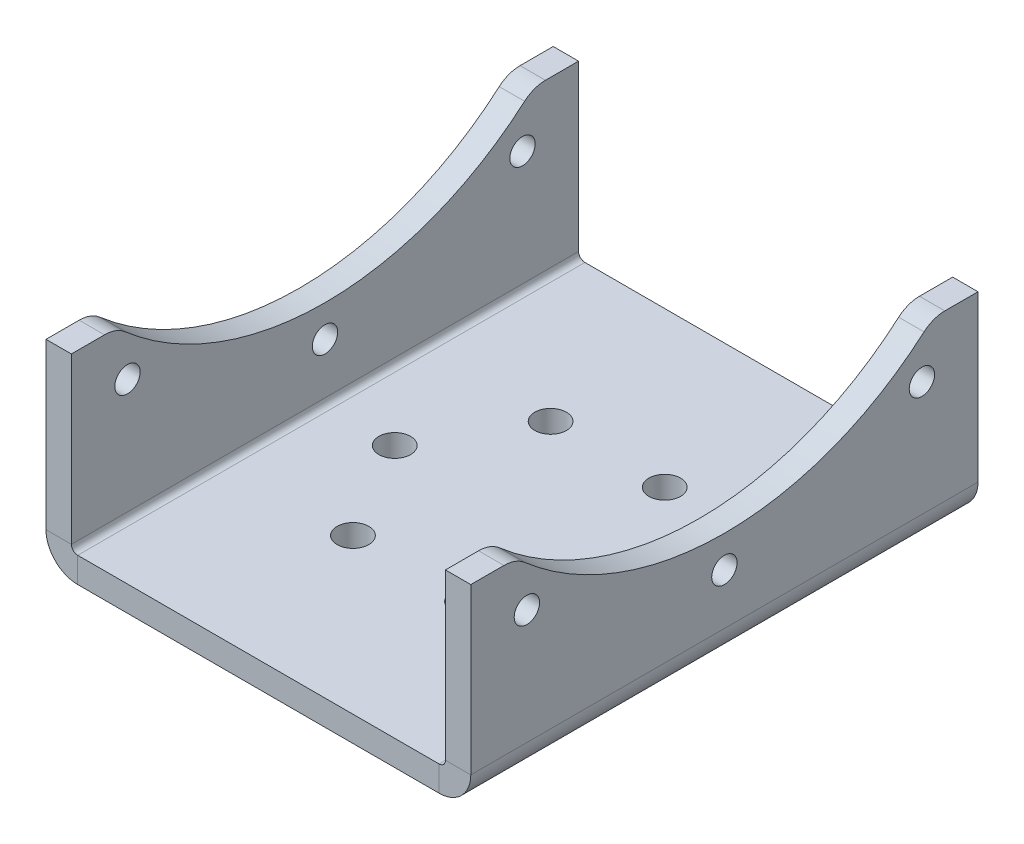
from build123d import *

# Parameters (mm, degrees)
SM_BASE_FLANGE_1_DEPTH   = 80
CUT_EXTRUDE_3_DEPTH      = 108.786826653
CUT_EXTRUDE_3_DEPTH_BACK = 108.786826653
SKETCH_6_R               = 48
SKETCH_6_R_2             = 2
FILLET_1_R               = 5
SKETCH_9_R               = 2.5
CUT_EXTRUDE_4_DEPTH      = 93.104560148


# Sheet-metal steps are written as plain solids
with BuildPart() as part:
    # Sketch 1 → Базовая кромка1 (new body)
    with BuildSketch(Plane.XY):
        with BuildLine():
            Line((-29.5, 27), (-29.5, 1))
            ThreePointArc((-29.5, 1), (-29.207106781, 0.292893219), (-28.5, 0))
            Line((-28.5, 0), (28.5, 0))
            ThreePointArc((28.5, 0), (29.207106781, 0.292893219), (29.5, 1))
            Line((29.5, 1), (29.5, 27))
            Line((29.5, 27), (33.5, 27))
            Line((33.5, 27), (33.5, 1))
            ThreePointArc((33.5, 1), (32.035533906, -2.535533906), (28.5, -4))
            Line((28.5, -4), (-28.5, -4))
            ThreePointArc((-28.5, -4), (-32.035533906, -2.535533906), (-33.5, 1))
            Line((-33.5, 1), (-33.5, 27))
            Line((-33.5, 27), (-29.5, 27))
        make_face()
    extrude(amount=SM_BASE_FLANGE_1_DEPTH)

    # Эскиз6 → Вырез-Вытянуть3 (cut, two sides: drawn at the far end of the back side and taken through both)
    with BuildSketch(Plane.ZY.offset(33.5).offset(-CUT_EXTRUDE_3_DEPTH_BACK)):
        with Locations((40, 62)):
            Circle(SKETCH_6_R)
        with Locations((40, 9)):
            Circle(SKETCH_6_R_2)
        with Locations((8.847381628, 19.122099298)):
            Circle(SKETCH_6_R_2)
        with Locations((71.152618372, 19.122099298)):
            Circle(SKETCH_6_R_2)
    extrude(amount=CUT_EXTRUDE_3_DEPTH + CUT_EXTRUDE_3_DEPTH_BACK, mode=Mode.SUBTRACT)

    # Скругление1
    fillet_1_edges = [part.edges().sort_by_distance(p)[0] for p in [
        (31.5, 27, 7.151864589),
        (31.5, 27, 72.848135411),
        (-31.5, 27, 7.151864589),
        (-31.5, 27, 72.848135411),
    ]]
    fillet(fillet_1_edges, radius=FILLET_1_R)

    # Эскиз9 → Вырез-Вытянуть4 (cut, through all)
    with BuildSketch(Plane.XZ.offset(4)):
        with Locations((17.5, 40)):
            Circle(SKETCH_9_R)
        with Locations((8.5, 24.411542732)):
            Circle(SKETCH_9_R)
        with Locations((-9.5, 24.411542732)):
            Circle(SKETCH_9_R)
        with Locations((-18.5, 40)):
            Circle(SKETCH_9_R)
        with Locations((-9.5, 55.588457268)):
            Circle(SKETCH_9_R)
        with Locations((8.5, 55.588457268)):
            Circle(SKETCH_9_R)
    extrude(amount=-CUT_EXTRUDE_4_DEPTH, mode=Mode.SUBTRACT)


solid = part.part
